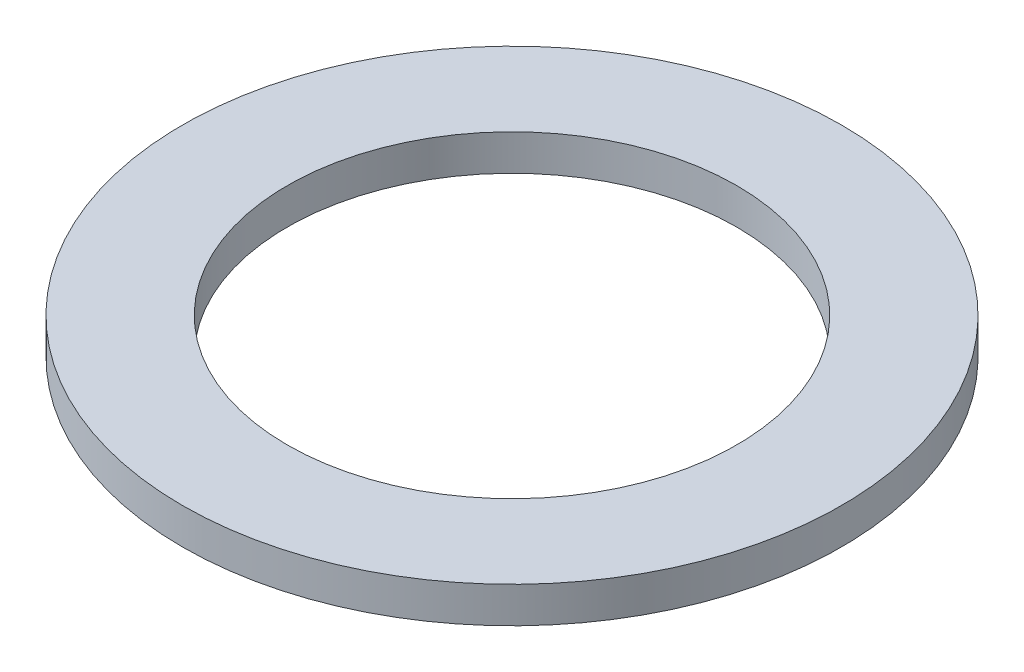
from build123d import *

# Parameters (mm, degrees)
SKETCH1_R           = 55
BOSS_EXTRUDE1_DEPTH = 6
SKETCH2_R           = 37.5
CUT_EXTRUDE1_DEPTH  = 79.012819459


with BuildPart() as part:
    # Sketch1 → Boss-Extrude1 (new body)
    with BuildSketch(Plane(origin=(0, 0, 0), x_dir=(1, 0, 0), z_dir=(0, 1, 0))):
        Circle(SKETCH1_R)
    extrude(amount=BOSS_EXTRUDE1_DEPTH)

    # Sketch2 → Cut-Extrude1 (cut, through all)
    with BuildSketch(Plane(origin=(0, 0, 0), x_dir=(1, 0, 0), z_dir=(0, 1, 0))):
        Circle(SKETCH2_R)
    extrude(amount=CUT_EXTRUDE1_DEPTH, mode=Mode.SUBTRACT)


solid = part.part
